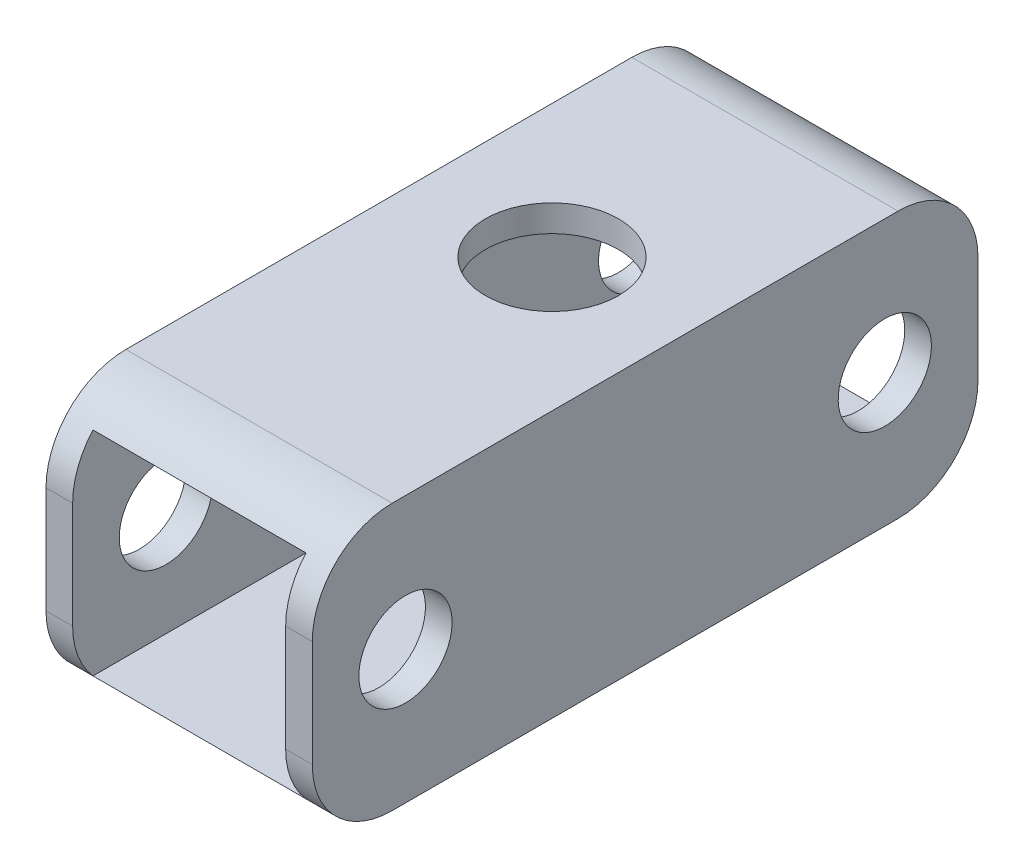
from build123d import *

# Parameters (mm, degrees)
SKIZZE1_W                       = 10
SKIZZE1_H                       = 10
SKIZZE1_W_2                     = 8
SKIZZE1_H_2                     = 8
AUFSATZ_LINEAR_AUSTRAGEN1_DEPTH = 30
SKIZZE2_R                       = 1.75
SCHNITT_LINEAR_AUSTRAGEN1_DEPTH = 35
SKIZZE3_R                       = 2.5
SCHNITT_LINEAR_AUSTRAGEN2_DEPTH = 17
FL_CHE_START                    = 27.5
FL_CHE_VERSCHIEBEN1_OUTLINE_W   = 10
FL_CHE_VERSCHIEBEN1_OUTLINE_H   = 10
FL_CHE_VERSCHIEBEN1_OUTLINE_W_2 = 8
FL_CHE_VERSCHIEBEN1_OUTLINE_H_2 = 8
FL_CHE_VERSCHIEBEN1_DEPTH       = 2.5
FL_CHE_VERSCHIEBEN2_OUTLINE_W   = 10
FL_CHE_VERSCHIEBEN2_OUTLINE_H   = 10
FL_CHE_VERSCHIEBEN2_OUTLINE_W_2 = 8
FL_CHE_VERSCHIEBEN2_OUTLINE_H_2 = 8
FL_CHE_VERSCHIEBEN2_DEPTH       = 2.5
VERRUNDUNG1_R                   = 3


# Read off the part's stored shape, not the designer's step: Fläche verschieben1, Fläche verschieben2
with BuildPart() as part:
    # Skizze1 → Aufsatz-Linear austragen1 (new body)
    with BuildSketch(Plane.XY):
        Rectangle(SKIZZE1_W, SKIZZE1_H)
        Rectangle(SKIZZE1_W_2, SKIZZE1_H_2, mode=Mode.SUBTRACT)
    extrude(amount=AUFSATZ_LINEAR_AUSTRAGEN1_DEPTH)

    # Skizze2 → Schnitt-Linear austragen1 (cut)
    with BuildSketch(Plane(origin=(5, 0, 0), x_dir=(0, 0, -1), z_dir=(1, 0, 0))):
        with Locations(Location((-6, 0, 0), (0, 0, 90))):
            Circle(SKIZZE2_R)
        with Locations(Location((-24, 0, 0), (0, 0, 90))):
            Circle(SKIZZE2_R)
    extrude(amount=-SCHNITT_LINEAR_AUSTRAGEN1_DEPTH, mode=Mode.SUBTRACT)

    # Skizze3 → Schnitt-Linear austragen2 (cut)
    with BuildSketch(Plane.XZ.offset(5)):
        with Locations((0, 13.5)):
            Circle(SKIZZE3_R)
    extrude(amount=-SCHNITT_LINEAR_AUSTRAGEN2_DEPTH, mode=Mode.SUBTRACT)

    # Fläche verschieben1 outline → Fläche verschieben1 (cut)
    with BuildSketch(Plane.XY.offset(FL_CHE_START)):
        Rectangle(FL_CHE_VERSCHIEBEN1_OUTLINE_W, FL_CHE_VERSCHIEBEN1_OUTLINE_H)
        Rectangle(FL_CHE_VERSCHIEBEN1_OUTLINE_W_2, FL_CHE_VERSCHIEBEN1_OUTLINE_H_2, mode=Mode.SUBTRACT)
    extrude(amount=FL_CHE_VERSCHIEBEN1_DEPTH, mode=Mode.SUBTRACT)

    # Fläche verschieben2 outline → Fläche verschieben2 (cut)
    with BuildSketch(Plane.XY):
        Rectangle(FL_CHE_VERSCHIEBEN2_OUTLINE_W, FL_CHE_VERSCHIEBEN2_OUTLINE_H)
        Rectangle(FL_CHE_VERSCHIEBEN2_OUTLINE_W_2, FL_CHE_VERSCHIEBEN2_OUTLINE_H_2, mode=Mode.SUBTRACT)
    extrude(amount=FL_CHE_VERSCHIEBEN2_DEPTH, mode=Mode.SUBTRACT)

    # Verrundung1
    # the kernel refuses this fillet: 3 mm, written as the material it takes off along each edge
    with BuildSketch(Plane(origin=(-12.5, -5, 2.5), x_dir=(0, 0, 1), z_dir=(1, 0, 0)), Plane(origin=(12.5, 5, 27.5), x_dir=(0, -1, 0), z_dir=(-1, 0, 0))) as verrundung1_piece_1:
        with BuildLine():
            CenterArc((VERRUNDUNG1_R, -VERRUNDUNG1_R), VERRUNDUNG1_R, 90, 90)
            Line((0, -VERRUNDUNG1_R), (0, 0))
            Line((0, 0), (VERRUNDUNG1_R, 0))
        make_face()
    extrude(amount=25, mode=Mode.SUBTRACT)
    with BuildSketch(Plane(origin=(12.5, 5, 2.5), x_dir=(0, -1, 0), z_dir=(-1, 0, 0)), Plane(origin=(-12.5, -5, 27.5), x_dir=(0, 0, -1), z_dir=(1, 0, 0))) as verrundung1_piece_2:
        with BuildLine():
            CenterArc((VERRUNDUNG1_R, VERRUNDUNG1_R), VERRUNDUNG1_R, 180, 90)
            Line((0, VERRUNDUNG1_R), (0, 0))
            Line((0, 0), (VERRUNDUNG1_R, 0))
        make_face()
    extrude(amount=25, mode=Mode.SUBTRACT)


solid = part.part
